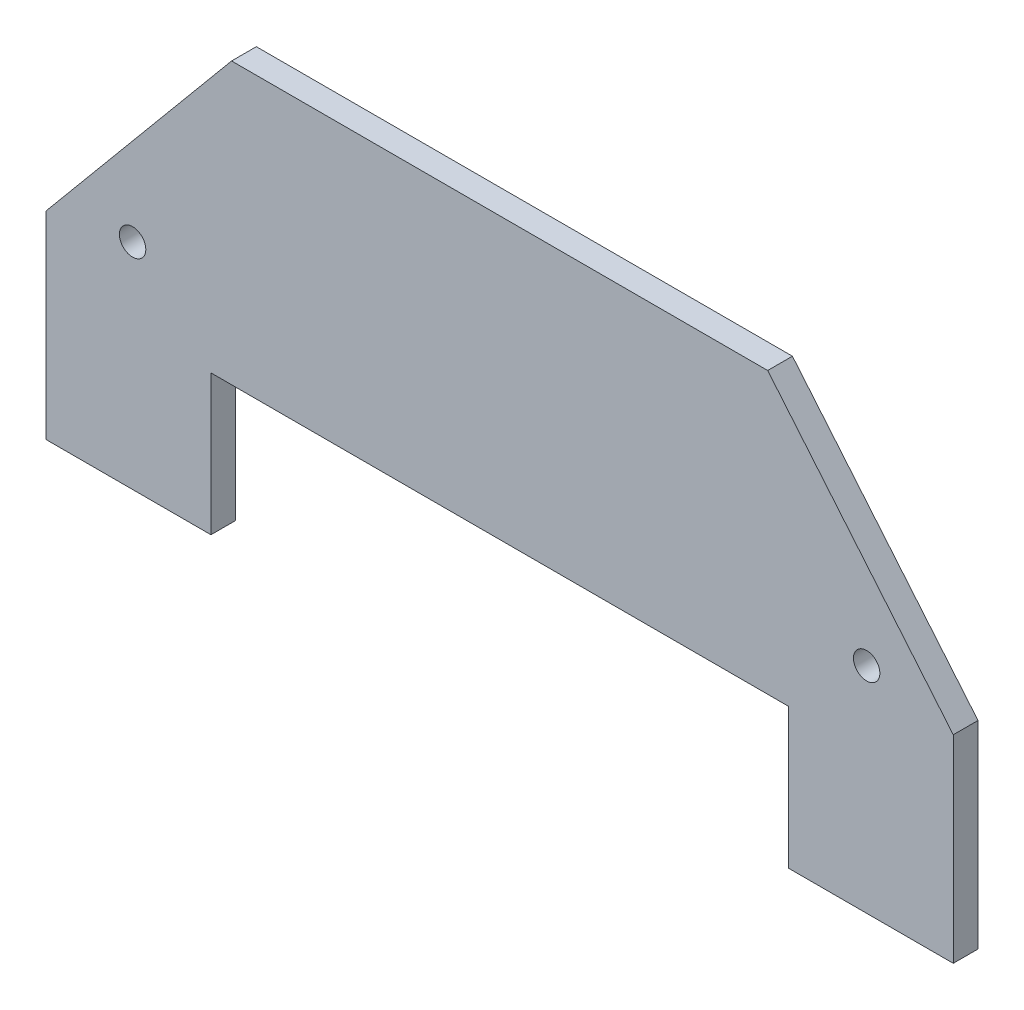
from build123d import *

# Parameters (mm, degrees)
SALIENTE_EXTRUIR1_DEPTH          = 3
TALADRO_DE_MARGEN_PARA_M31_D     = 3.2
TALADRO_DE_MARGEN_PARA_M31_DEPTH = 5
TALADRO_DE_MARGEN_PARA_M31_TIP   = 0.96137699
CORTAR_EXTRUIR1_REACH            = 77.067
CROQUIS4_W                       = 70
CROQUIS4_H                       = 17


with BuildPart() as part:
    # Croquis1 → Saliente-Extruir1 (new body)
    with BuildSketch(Plane.XY):
        Polygon((-55, 0), (55, 0), (55, 24), (32.5, 51), (-32.5, 51), (-55, 24), align=None)
    extrude(amount=SALIENTE_EXTRUIR1_DEPTH)

    # Taladro de margen para M31
    with Locations(Plane(origin=(44.5, 26, 0), x_dir=(-1, 0, 0), z_dir=(0, 0, -1))):
        with Locations((0, 0), (89, 0)):
            Hole(TALADRO_DE_MARGEN_PARA_M31_D / 2, depth=TALADRO_DE_MARGEN_PARA_M31_DEPTH)
            with Locations((0, 0, -(TALADRO_DE_MARGEN_PARA_M31_DEPTH + TALADRO_DE_MARGEN_PARA_M31_TIP / 2))):  # 118° drill point
                Cone(0, TALADRO_DE_MARGEN_PARA_M31_D / 2, TALADRO_DE_MARGEN_PARA_M31_TIP, mode=Mode.SUBTRACT)

    # Croquis4 → Cortar-Extruir1 (cut, up to next)
    with BuildSketch(Plane.XY.offset(3), mode=Mode.PRIVATE) as cortar_extruir1_sk1:
        with Locations((0, 8.5)):
            Rectangle(CROQUIS4_W, CROQUIS4_H)
    cortar_extruir1_tool1 = extrude(cortar_extruir1_sk1.sketch, amount=-CORTAR_EXTRUIR1_REACH, mode=Mode.PRIVATE) & part.part
    add(cortar_extruir1_tool1.solids().sort_by_distance((0, 8.5, 3))[0], mode=Mode.SUBTRACT)


solid = part.part
